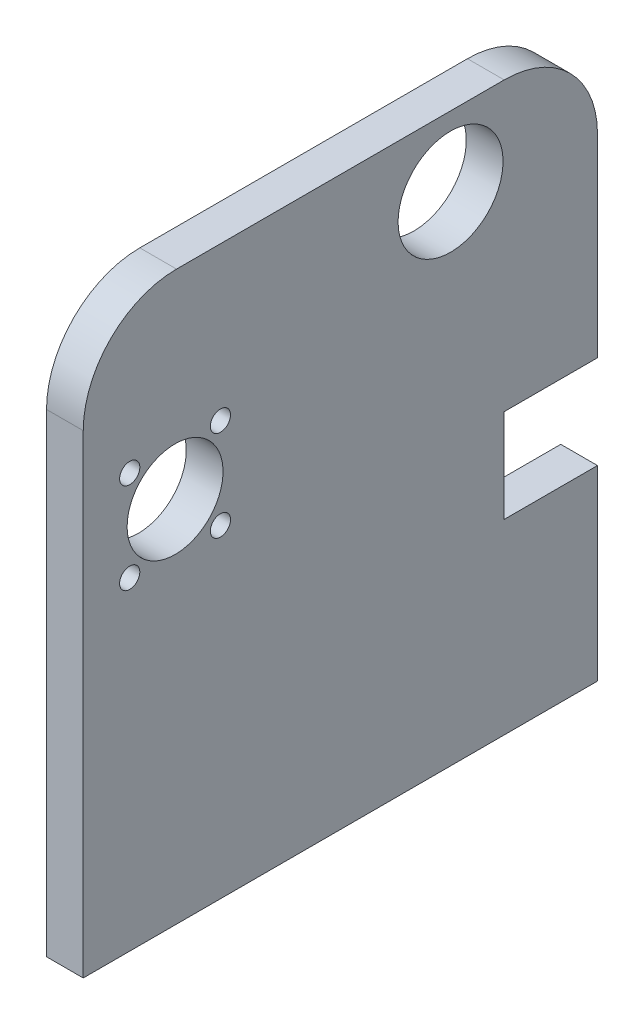
from build123d import *

# Parameters (mm, degrees)
SKETCH1_W           = 10
SKETCH1_H           = 140
BOSS_EXTRUDE1_DEPTH = 77.221817616
FILLET1_R           = 25.4
SKETCH3_R           = 14.29
SKETCH3_R_2         = 2.75
SKETCH3_R_3         = 13.0556
CUT_EXTRUDE2_DEPTH  = 28.575
SKETCH5_W           = 25.4
SKETCH5_H           = 25.4
CUT_EXTRUDE4_DEPTH  = 105.705344257


with BuildPart() as part:
    # Sketch1 → Boss-Extrude1 (new, symmetric)
    with BuildSketch(Plane(origin=(0, 0, 0), x_dir=(1, 0, 0), z_dir=(0, 1, 0))):
        Rectangle(SKETCH1_W, SKETCH1_H)
    extrude(amount=BOSS_EXTRUDE1_DEPTH, both=True)

    # Fillet1
    fillet1_edges = [part.edges().sort_by_distance(p)[0] for p in [
        (0, 77.221817616, 70),
        (0, 77.221817616, -70),
    ]]
    fillet(fillet1_edges, radius=FILLET1_R)

    # Sketch3 → Cut-Extrude2 (cut)
    with BuildSketch(Plane.ZY.offset(5)):
        with Locations((-30, 58.171817616)):
            Circle(SKETCH3_R)
        with Locations((32.652147834, 35.519669782)):
            Circle(SKETCH3_R_2)
        with Locations((57.347852166, 35.519669782)):
            Circle(SKETCH3_R_2)
        with Locations((32.652147834, 10.82396545)):
            Circle(SKETCH3_R_2)
        with Locations((57.347852166, 10.82396545)):
            Circle(SKETCH3_R_2)
        with Locations((45, 23.171817616)):
            Circle(SKETCH3_R_3)
    extrude(amount=-CUT_EXTRUDE2_DEPTH, mode=Mode.SUBTRACT)

    # Sketch5 → Cut-Extrude4 (cut, through all)
    with BuildSketch(Plane.ZY.offset(5)):
        with Locations((-57.3, -13.696417616)):
            Rectangle(SKETCH5_W, SKETCH5_H)
    extrude(amount=-CUT_EXTRUDE4_DEPTH, mode=Mode.SUBTRACT)


solid = part.part
